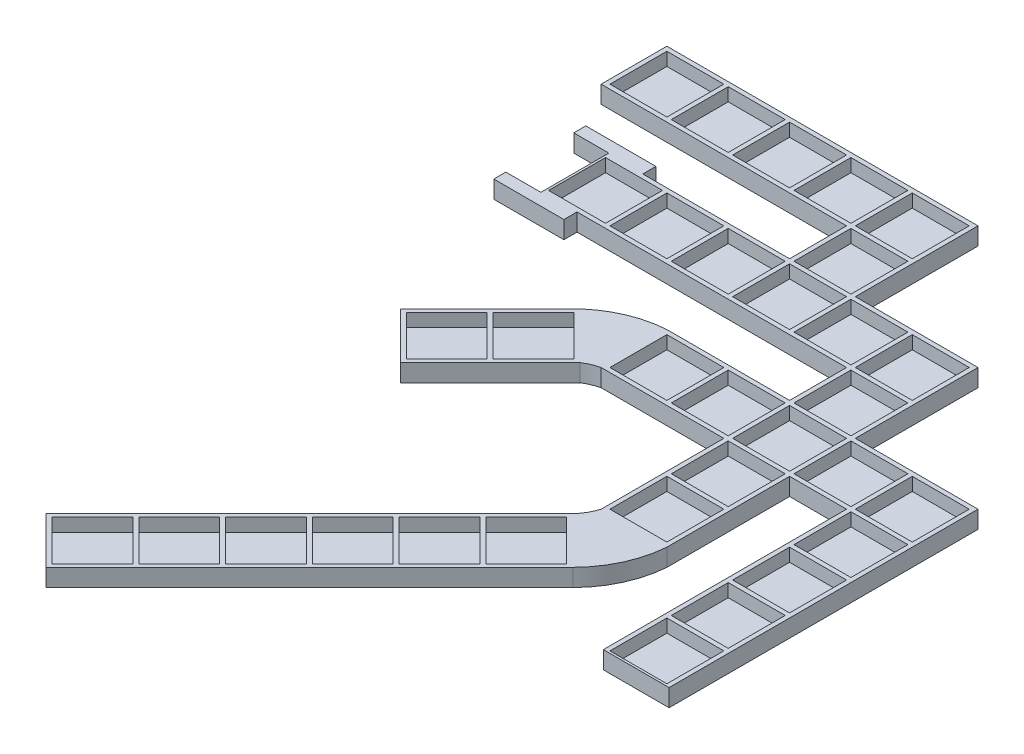
from build123d import *

# Parameters (mm, degrees)
ESQUISSE1_W                     = 15
ESQUISSE1_H                     = 15
BOSS_EXTRU_1_DEPTH              = 4
ESQUISSE2_W                     = 13
ESQUISSE2_H                     = 13
ENL_V_MAT_EXTRU_2_DEPTH         = 3
R_P_T_PAR_ESQUISSE3_DEPTH       = 1
R_P_T_START                     = 1
R_P_T_PAR_ESQUISSE3_2_OUTLINE_W = 13
R_P_T_PAR_ESQUISSE3_2_OUTLINE_H = 13
R_P_T_PAR_ESQUISSE3_2_DEPTH     = 3
BOSS_EXTRU_2_DEPTH              = 4
ENL_V_MAT_EXTRU_3_DEPTH         = 3
R_P_T_PAR_ESQUISSE5_DEPTH       = 1
R_P_T_PAR_ESQUISSE5_2_DEPTH     = 3
R_P_T_PAR_ESQUISSE5_3_DEPTH     = 1
R_P_T_PAR_ESQUISSE5_4_DEPTH     = 3
R_P_T_PAR_ESQUISSE5_5_DEPTH     = 1
R_P_T_PAR_ESQUISSE5_6_DEPTH     = 3
R_P_T_PAR_ESQUISSE5_7_DEPTH     = 1
R_P_T_PAR_ESQUISSE5_8_DEPTH     = 3
R_P_T_PAR_ESQUISSE5_9_DEPTH     = 1
R_P_T_PAR_ESQUISSE5_10_DEPTH    = 3
R_P_T_PAR_ESQUISSE5_11_DEPTH    = 1
R_P_T_PAR_ESQUISSE5_12_DEPTH    = 3
R_P_T_PAR_ESQUISSE5_13_DEPTH    = 1
R_P_T_PAR_ESQUISSE5_14_DEPTH    = 3
R_P_T_PAR_ESQUISSE5_15_DEPTH    = 1
R_P_T_PAR_ESQUISSE5_16_DEPTH    = 3
BOSS_EXTRU_3_DEPTH              = 4
BOSS_EXTRU_4_DEPTH              = 4
ESQUISSE11_W                    = 18.28342907
ESQUISSE11_H                    = 7.953808126
ENL_V_MAT_EXTRU_4_DEPTH         = 0.5
ESQUISSE12_W                    = 19.816809157
ESQUISSE12_H                    = 9.400847105
ENL_V_MAT_EXTRU_5_DEPTH         = 0.5
BOSS_EXTRU_5_DEPTH              = 8
BOSS_EXTRU_5_DEPTH_BACK         = 8
ESQUISSE15_W                    = 3
ESQUISSE15_H                    = 4
ESQUISSE16_W                    = 15.5
ESQUISSE16_H                    = 4
ENL_V_MAT_EXTRU_8_DEPTH         = 8


with BuildPart() as part:
    # Esquisse1 → Boss.-Extru.1 (new body)
    with BuildSketch(Plane(origin=(0, 0, 0), x_dir=(1, 0, 0), z_dir=(0, 1, 0))):
        with Locations((-24.480337079, 23.132022472)):
            Rectangle(ESQUISSE1_W, ESQUISSE1_H)
    extrude(amount=BOSS_EXTRU_1_DEPTH)

    # Esquisse2 → Enlèv. mat.-Extru.2 (cut)
    with BuildSketch(Plane(origin=(0, 4, 0), x_dir=(1, 0, 0), z_dir=(0, 1, 0))):
        with Locations((-24.480337079, 23.132022472)):
            Rectangle(ESQUISSE2_W, ESQUISSE2_H)
    extrude(amount=-ENL_V_MAT_EXTRU_2_DEPTH, mode=Mode.SUBTRACT)

    # Répét. par esquisse3: read off the stored shape, not the designer's step
    # Répét. par esquisse3 outline → Répét. par esquisse3 (add)
    with BuildSketch(Plane(origin=(0, 0, 0), x_dir=(1, 0, 0), z_dir=(0, 1, 0))):
        Polygon((-16.980337079, 15.632022472), (38.019662921, 15.632022472), (38.019662921, 2.632022472), (10.019662921, 2.632022472), (10.019662921, -12.367977528), (38.019662921, -12.367977528), (38.019662921, -40.367977528), (53.019662921, -40.367977528), (53.019662921, -12.367977528), (66.019662921, -12.367977528), (66.019662921, -68.367977528), (81.019662921, -68.367977528), (81.019662921, 2.632022472), (53.019662921, 2.632022472), (53.019662921, 30.632022472), (25.019662921, 30.632022472), (25.019662921, 58.632022472), (-45.980337079, 58.632022472), (-45.980337079, 43.632022472), (10.019662921, 43.632022472), (10.019662921, 30.632022472), (-16.980337079, 30.632022472), align=None)
    extrude(amount=R_P_T_PAR_ESQUISSE3_DEPTH)

    # R_p_t. par esquisse3 2 outline → R_p_t. par esquisse3 2 (add)
    with BuildSketch(Plane(origin=(0, 0, 0), x_dir=(1, 0, 0), z_dir=(0, 1, 0)).offset(R_P_T_START)):
        Polygon((-16.980337079, 15.632022472), (38.019662921, 15.632022472), (38.019662921, 2.632022472), (10.019662921, 2.632022472), (10.019662921, -12.367977528), (38.019662921, -12.367977528), (38.019662921, -40.367977528), (53.019662921, -40.367977528), (53.019662921, -12.367977528), (66.019662921, -12.367977528), (66.019662921, -68.367977528), (81.019662921, -68.367977528), (81.019662921, 2.632022472), (53.019662921, 2.632022472), (53.019662921, 30.632022472), (25.019662921, 30.632022472), (25.019662921, 58.632022472), (-45.980337079, 58.632022472), (-45.980337079, 43.632022472), (10.019662921, 43.632022472), (10.019662921, 30.632022472), (-16.980337079, 30.632022472), (-16.980337079, 29.632022472), (-3.980337079, 29.632022472), (-3.980337079, 16.632022472), (-16.980337079, 16.632022472), align=None)
        with Locations((73.519662921, -60.867977528)):
            Rectangle(R_P_T_PAR_ESQUISSE3_2_OUTLINE_W, R_P_T_PAR_ESQUISSE3_2_OUTLINE_H, mode=Mode.SUBTRACT)
        with Locations((73.519662921, -46.867977528)):
            Rectangle(R_P_T_PAR_ESQUISSE3_2_OUTLINE_W, R_P_T_PAR_ESQUISSE3_2_OUTLINE_H, mode=Mode.SUBTRACT)
        with Locations((45.519662921, -32.867977528)):
            Rectangle(R_P_T_PAR_ESQUISSE3_2_OUTLINE_W, R_P_T_PAR_ESQUISSE3_2_OUTLINE_H, mode=Mode.SUBTRACT)
        with Locations((45.519662921, -18.867977528)):
            Rectangle(R_P_T_PAR_ESQUISSE3_2_OUTLINE_W, R_P_T_PAR_ESQUISSE3_2_OUTLINE_H, mode=Mode.SUBTRACT)
        with Locations((73.519662921, -32.867977528)):
            Rectangle(R_P_T_PAR_ESQUISSE3_2_OUTLINE_W, R_P_T_PAR_ESQUISSE3_2_OUTLINE_H, mode=Mode.SUBTRACT)
        with Locations((73.519662921, -18.867977528)):
            Rectangle(R_P_T_PAR_ESQUISSE3_2_OUTLINE_W, R_P_T_PAR_ESQUISSE3_2_OUTLINE_H, mode=Mode.SUBTRACT)
        with Locations((3.519662921, 23.132022472)):
            Rectangle(R_P_T_PAR_ESQUISSE3_2_OUTLINE_W, R_P_T_PAR_ESQUISSE3_2_OUTLINE_H, mode=Mode.SUBTRACT)
        with Locations((-38.480337079, 51.132022472)):
            Rectangle(R_P_T_PAR_ESQUISSE3_2_OUTLINE_W, R_P_T_PAR_ESQUISSE3_2_OUTLINE_H, mode=Mode.SUBTRACT)
        with Locations((-24.480337079, 51.132022472)):
            Rectangle(R_P_T_PAR_ESQUISSE3_2_OUTLINE_W, R_P_T_PAR_ESQUISSE3_2_OUTLINE_H, mode=Mode.SUBTRACT)
        with Locations((-10.480337079, 51.132022472)):
            Rectangle(R_P_T_PAR_ESQUISSE3_2_OUTLINE_W, R_P_T_PAR_ESQUISSE3_2_OUTLINE_H, mode=Mode.SUBTRACT)
        with Locations((3.519662921, 51.132022472)):
            Rectangle(R_P_T_PAR_ESQUISSE3_2_OUTLINE_W, R_P_T_PAR_ESQUISSE3_2_OUTLINE_H, mode=Mode.SUBTRACT)
        with Locations((17.519662921, -4.867977528)):
            Rectangle(R_P_T_PAR_ESQUISSE3_2_OUTLINE_W, R_P_T_PAR_ESQUISSE3_2_OUTLINE_H, mode=Mode.SUBTRACT)
        with Locations((31.519662921, -4.867977528)):
            Rectangle(R_P_T_PAR_ESQUISSE3_2_OUTLINE_W, R_P_T_PAR_ESQUISSE3_2_OUTLINE_H, mode=Mode.SUBTRACT)
        with Locations((45.519662921, -4.867977528)):
            Rectangle(R_P_T_PAR_ESQUISSE3_2_OUTLINE_W, R_P_T_PAR_ESQUISSE3_2_OUTLINE_H, mode=Mode.SUBTRACT)
        with Locations((45.519662921, 9.132022472)):
            Rectangle(R_P_T_PAR_ESQUISSE3_2_OUTLINE_W, R_P_T_PAR_ESQUISSE3_2_OUTLINE_H, mode=Mode.SUBTRACT)
        with Locations((17.519662921, 23.132022472)):
            Rectangle(R_P_T_PAR_ESQUISSE3_2_OUTLINE_W, R_P_T_PAR_ESQUISSE3_2_OUTLINE_H, mode=Mode.SUBTRACT)
        with Locations((31.519662921, 23.132022472)):
            Rectangle(R_P_T_PAR_ESQUISSE3_2_OUTLINE_W, R_P_T_PAR_ESQUISSE3_2_OUTLINE_H, mode=Mode.SUBTRACT)
        with Locations((45.519662921, 23.132022472)):
            Rectangle(R_P_T_PAR_ESQUISSE3_2_OUTLINE_W, R_P_T_PAR_ESQUISSE3_2_OUTLINE_H, mode=Mode.SUBTRACT)
        with Locations((59.519662921, -4.867977528)):
            Rectangle(R_P_T_PAR_ESQUISSE3_2_OUTLINE_W, R_P_T_PAR_ESQUISSE3_2_OUTLINE_H, mode=Mode.SUBTRACT)
        with Locations((73.519662921, -4.867977528)):
            Rectangle(R_P_T_PAR_ESQUISSE3_2_OUTLINE_W, R_P_T_PAR_ESQUISSE3_2_OUTLINE_H, mode=Mode.SUBTRACT)
        with Locations((17.519662921, 37.132022472)):
            Rectangle(R_P_T_PAR_ESQUISSE3_2_OUTLINE_W, R_P_T_PAR_ESQUISSE3_2_OUTLINE_H, mode=Mode.SUBTRACT)
        with Locations((17.519662921, 51.132022472)):
            Rectangle(R_P_T_PAR_ESQUISSE3_2_OUTLINE_W, R_P_T_PAR_ESQUISSE3_2_OUTLINE_H, mode=Mode.SUBTRACT)
    extrude(amount=R_P_T_PAR_ESQUISSE3_2_DEPTH)



with BuildPart() as body_2:
    # Esquisse7 → Boss.-Extru.2 (new body)
    with BuildSketch(Plane(origin=(0, 0, 0), x_dir=(1, 0, 0), z_dir=(0, 1, 0))):
        Polygon((35.663061204, -44.492165732), (46.269662921, -55.09876745), (35.663061204, -65.705369168), (25.056459486, -55.09876745), align=None)
    extrude(amount=BOSS_EXTRU_2_DEPTH)

    # Esquisse8 → Enlèv. mat.-Extru.3 (cut)
    with BuildSketch(Plane(origin=(0, 4, 0), x_dir=(1, 0, 0), z_dir=(0, 1, 0))):
        Polygon((35.663061204, -45.906379295), (44.855449359, -55.09876745), (35.663061204, -64.291155606), (26.470673048, -55.09876745), align=None)
    extrude(amount=-ENL_V_MAT_EXTRU_3_DEPTH, mode=Mode.SUBTRACT)


with BuildPart() as body_3:
    # Répét. par esquisse5: read off the stored shape, not the designer's step
    # Répét. par esquisse5 outline → Répét. par esquisse5 (new body)
    with BuildSketch(Plane(origin=(0, 0, 0), x_dir=(1, 0, 0), z_dir=(0, 1, 0))):
        Polygon((-13.880041219, -13.098053183), (-24.486642937, -23.7046549), (-13.880041219, -34.311256618), (-3.273439502, -23.7046549), align=None)
    extrude(amount=R_P_T_PAR_ESQUISSE5_DEPTH)

    # R_p_t. par esquisse5 2 outline → R_p_t. par esquisse5 2 (add)
    with BuildSketch(Plane(origin=(0, 0, 0), x_dir=(1, 0, 0), z_dir=(0, 1, 0)).offset(R_P_T_START)):
        Polygon((-13.880041219, -13.098053183), (-24.486642937, -23.7046549), (-13.880041219, -34.311256618), (-3.273439502, -23.7046549), align=None)
        Polygon((-13.880041219, -14.512266745), (-4.687653064, -23.7046549), (-13.880041219, -32.897043056), (-23.072429375, -23.7046549), align=None, mode=Mode.SUBTRACT)
    extrude(amount=R_P_T_PAR_ESQUISSE5_2_DEPTH)


with BuildPart() as body_4:
    # R_p_t. par esquisse5 3 outline → R_p_t. par esquisse5 3 (new body)
    with BuildSketch(Plane(origin=(0, 0, 0), x_dir=(1, 0, 0), z_dir=(0, 1, 0))):
        Polygon((-3.980546283, -3.198558246), (-14.587148001, -13.805159964), (-3.980546283, -24.411761682), (6.626055435, -13.805159964), align=None)
    extrude(amount=R_P_T_PAR_ESQUISSE5_3_DEPTH)

    # R_p_t. par esquisse5 4 outline → R_p_t. par esquisse5 4 (add)
    with BuildSketch(Plane(origin=(0, 0, 0), x_dir=(1, 0, 0), z_dir=(0, 1, 0)).offset(R_P_T_START)):
        Polygon((-3.980546283, -3.198558246), (-14.587148001, -13.805159964), (-3.980546283, -24.411761682), (6.626055435, -13.805159964), align=None)
        Polygon((-3.980546283, -4.612771808), (5.211841873, -13.805159964), (-3.980546283, -22.997548119), (-13.172934438, -13.805159964), align=None, mode=Mode.SUBTRACT)
    extrude(amount=R_P_T_PAR_ESQUISSE5_4_DEPTH)


with BuildPart() as body_5:
    # R_p_t. par esquisse5 5 outline → R_p_t. par esquisse5 5 (new body)
    with BuildSketch(Plane(origin=(0, 0, 0), x_dir=(1, 0, 0), z_dir=(0, 1, 0))):
        Polygon((25.763566267, -54.391660669), (15.156964549, -64.998262387), (25.763566267, -75.604864104), (36.370167985, -64.998262387), align=None)
    extrude(amount=R_P_T_PAR_ESQUISSE5_5_DEPTH)

    # R_p_t. par esquisse5 6 outline → R_p_t. par esquisse5 6 (add)
    with BuildSketch(Plane(origin=(0, 0, 0), x_dir=(1, 0, 0), z_dir=(0, 1, 0)).offset(R_P_T_START)):
        Polygon((25.763566267, -54.391660669), (15.156964549, -64.998262387), (25.763566267, -75.604864104), (36.370167985, -64.998262387), align=None)
        Polygon((25.763566267, -55.805874231), (34.955954422, -64.998262387), (25.763566267, -74.190650542), (16.571178112, -64.998262387), align=None, mode=Mode.SUBTRACT)
    extrude(amount=R_P_T_PAR_ESQUISSE5_6_DEPTH)


with BuildPart() as body_6:
    # R_p_t. par esquisse5 7 outline → R_p_t. par esquisse5 7 (new body)
    with BuildSketch(Plane(origin=(0, 0, 0), x_dir=(1, 0, 0), z_dir=(0, 1, 0))):
        Polygon((15.86407133, -64.291155606), (5.257469613, -74.897757323), (15.86407133, -85.504359041), (26.470673048, -74.897757323), align=None)
    extrude(amount=R_P_T_PAR_ESQUISSE5_7_DEPTH)

    # R_p_t. par esquisse5 8 outline → R_p_t. par esquisse5 8 (add)
    with BuildSketch(Plane(origin=(0, 0, 0), x_dir=(1, 0, 0), z_dir=(0, 1, 0)).offset(R_P_T_START)):
        Polygon((15.86407133, -64.291155606), (5.257469613, -74.897757323), (15.86407133, -85.504359041), (26.470673048, -74.897757323), align=None)
        Polygon((15.86407133, -65.705369168), (25.056459486, -74.897757323), (15.86407133, -84.090145479), (6.671683175, -74.897757323), align=None, mode=Mode.SUBTRACT)
    extrude(amount=R_P_T_PAR_ESQUISSE5_8_DEPTH)


with BuildPart() as body_7:
    # R_p_t. par esquisse5 9 outline → R_p_t. par esquisse5 9 (new body)
    with BuildSketch(Plane(origin=(0, 0, 0), x_dir=(1, 0, 0), z_dir=(0, 1, 0))):
        Polygon((5.964576394, -74.190650542), (-4.642025324, -84.79725226), (5.964576394, -95.403853978), (16.571178112, -84.79725226), align=None)
    extrude(amount=R_P_T_PAR_ESQUISSE5_9_DEPTH)

    # R_p_t. par esquisse5 10 outline → R_p_t. par esquisse5 10 (add)
    with BuildSketch(Plane(origin=(0, 0, 0), x_dir=(1, 0, 0), z_dir=(0, 1, 0)).offset(R_P_T_START)):
        Polygon((5.964576394, -74.190650542), (-4.642025324, -84.79725226), (5.964576394, -95.403853978), (16.571178112, -84.79725226), align=None)
        Polygon((5.964576394, -75.604864104), (15.156964549, -84.79725226), (5.964576394, -93.989640415), (-3.227811762, -84.79725226), align=None, mode=Mode.SUBTRACT)
    extrude(amount=R_P_T_PAR_ESQUISSE5_10_DEPTH)


with BuildPart() as body_8:
    # R_p_t. par esquisse5 11 outline → R_p_t. par esquisse5 11 (new body)
    with BuildSketch(Plane(origin=(0, 0, 0), x_dir=(1, 0, 0), z_dir=(0, 1, 0))):
        Polygon((-3.934918543, -84.090145479), (-14.541520261, -94.696747197), (-3.934918543, -105.303348914), (6.671683175, -94.696747197), align=None)
    extrude(amount=R_P_T_PAR_ESQUISSE5_11_DEPTH)

    # R_p_t. par esquisse5 12 outline → R_p_t. par esquisse5 12 (add)
    with BuildSketch(Plane(origin=(0, 0, 0), x_dir=(1, 0, 0), z_dir=(0, 1, 0)).offset(R_P_T_START)):
        Polygon((-3.934918543, -84.090145479), (-14.541520261, -94.696747197), (-3.934918543, -105.303348914), (6.671683175, -94.696747197), align=None)
        Polygon((-3.934918543, -85.504359041), (5.257469613, -94.696747197), (-3.934918543, -103.889135352), (-13.127306698, -94.696747197), align=None, mode=Mode.SUBTRACT)
    extrude(amount=R_P_T_PAR_ESQUISSE5_12_DEPTH)


with BuildPart() as body_9:
    # R_p_t. par esquisse5 13 outline → R_p_t. par esquisse5 13 (new body)
    with BuildSketch(Plane(origin=(0, 0, 0), x_dir=(1, 0, 0), z_dir=(0, 1, 0))):
        Polygon((-13.83441348, -93.989640415), (-24.441015197, -104.596242133), (-13.83441348, -115.202843851), (-3.227811762, -104.596242133), align=None)
    extrude(amount=R_P_T_PAR_ESQUISSE5_13_DEPTH)

    # R_p_t. par esquisse5 14 outline → R_p_t. par esquisse5 14 (add)
    with BuildSketch(Plane(origin=(0, 0, 0), x_dir=(1, 0, 0), z_dir=(0, 1, 0)).offset(R_P_T_START)):
        Polygon((-13.83441348, -93.989640415), (-24.441015197, -104.596242133), (-13.83441348, -115.202843851), (-3.227811762, -104.596242133), align=None)
        Polygon((-13.83441348, -95.403853978), (-4.642025324, -104.596242133), (-13.83441348, -113.788630289), (-23.026801635, -104.596242133), align=None, mode=Mode.SUBTRACT)
    extrude(amount=R_P_T_PAR_ESQUISSE5_14_DEPTH)


with BuildPart() as body_10:
    # R_p_t. par esquisse5 15 outline → R_p_t. par esquisse5 15 (new body)
    with BuildSketch(Plane(origin=(0, 0, 0), x_dir=(1, 0, 0), z_dir=(0, 1, 0))):
        Polygon((35.663061204, -44.492165732), (25.056459486, -55.09876745), (35.663061204, -65.705369168), (46.269662921, -55.09876745), align=None)
    extrude(amount=R_P_T_PAR_ESQUISSE5_15_DEPTH)

    # R_p_t. par esquisse5 16 outline → R_p_t. par esquisse5 16 (add)
    with BuildSketch(Plane(origin=(0, 0, 0), x_dir=(1, 0, 0), z_dir=(0, 1, 0)).offset(R_P_T_START)):
        Polygon((35.663061204, -44.492165732), (25.056459486, -55.09876745), (35.663061204, -65.705369168), (46.269662921, -55.09876745), align=None)
        Polygon((35.663061204, -45.906379295), (44.855449359, -55.09876745), (35.663061204, -64.291155606), (26.470673048, -55.09876745), align=None, mode=Mode.SUBTRACT)
    extrude(amount=R_P_T_PAR_ESQUISSE5_16_DEPTH)


with BuildPart() as part_1:
    add(part.part)

    add(body_2.part)  # Boss.-Extru.3 merges body 2

    add(body_10.part)  # Boss.-Extru.3 merges body 10
    # Esquisse9 → Boss.-Extru.3 (add)
    with BuildSketch(Plane(origin=(0, 0, 0), x_dir=(1, 0, 0), z_dir=(0, 1, 0))):
        with BuildLine():
            Line((38.019662921, -40.367977528), (53.019662921, -40.367977528))
            ThreePointArc((53.019662921, -40.367977528), (50.961456335, -48.336758702), (46.269662921, -55.09876745))
            Line((46.269662921, -55.09876745), (35.663061204, -44.492165732))
            ThreePointArc((35.663061204, -44.492165732), (37.068260316, -42.559723525), (38.019662921, -40.367977528))
        make_face()
    extrude(amount=BOSS_EXTRU_3_DEPTH)

    # Esquisse10 → Boss.-Extru.4 (add)
    with BuildSketch(Plane(origin=(0, 0, 0), x_dir=(-0.7071067811865709, 0, -0.7071067811865243), z_dir=(0, 1, 0))):
        with BuildLine():
            Line((-14.447050956, 5.076393495), (0.552949044, 5.076393495))
            ThreePointArc((0.552949044, 5.076393495), (-1.167023322, -2.416202936), (-5.223850659, -8.946092535))
            Line((-5.223850659, -8.946092535), (-15.830452377, 1.660509183))
            ThreePointArc((-15.830452377, 1.660509183), (-14.993646767, 3.309685202), (-14.447050956, 5.076393495))
        make_face()
    extrude(amount=BOSS_EXTRU_4_DEPTH)

    # Esquisse11 → Enlèv. mat.-Extru.4 (cut)
    with BuildSketch(Plane.ZY.offset(31.980337079)):
        with Locations((-23.340148818, 1.450873115)):
            Rectangle(ESQUISSE11_W, ESQUISSE11_H)
    extrude(amount=-ENL_V_MAT_EXTRU_4_DEPTH, mode=Mode.SUBTRACT)

    # Esquisse12 → Enlèv. mat.-Extru.5 (cut)
    with BuildSketch(Plane.XY.offset(68.367977528)):
        with Locations((74.06502355, 1.709886988)):
            Rectangle(ESQUISSE12_W, ESQUISSE12_H)
    extrude(amount=-ENL_V_MAT_EXTRU_5_DEPTH, mode=Mode.SUBTRACT)

    # Esquisse15 → Boss.-Extru.5 (add, two sides: drawn at the far end of the back side and taken through both)
    with BuildSketch(Plane.ZY.offset(31.480337079).offset(-BOSS_EXTRU_5_DEPTH_BACK)):
        with Locations((-14.132022472, 2)):
            Rectangle(ESQUISSE15_W, ESQUISSE15_H)
        with Locations((-32.132022472, 2)):
            Rectangle(ESQUISSE15_W, ESQUISSE15_H)
    extrude(amount=BOSS_EXTRU_5_DEPTH + BOSS_EXTRU_5_DEPTH_BACK)

    # Esquisse16 → Enlèv. mat.-Extru.8 (cut)
    with BuildSketch(Plane.ZY.offset(39.480337079)):
        with Locations((-23.132022472, 2)):
            Rectangle(ESQUISSE16_W, ESQUISSE16_H)
    extrude(amount=-ENL_V_MAT_EXTRU_8_DEPTH, mode=Mode.SUBTRACT)

    # Combiner1: read off the stored shape, not the designer's step
    # Combiner1: union body 3, body 4, body 5, body 6, body 7, body 8, body 9
    add(body_3.part)
    add(body_4.part)
    add(body_5.part)
    add(body_6.part)
    add(body_7.part)
    add(body_8.part)
    add(body_9.part)


solid = part_1.part
